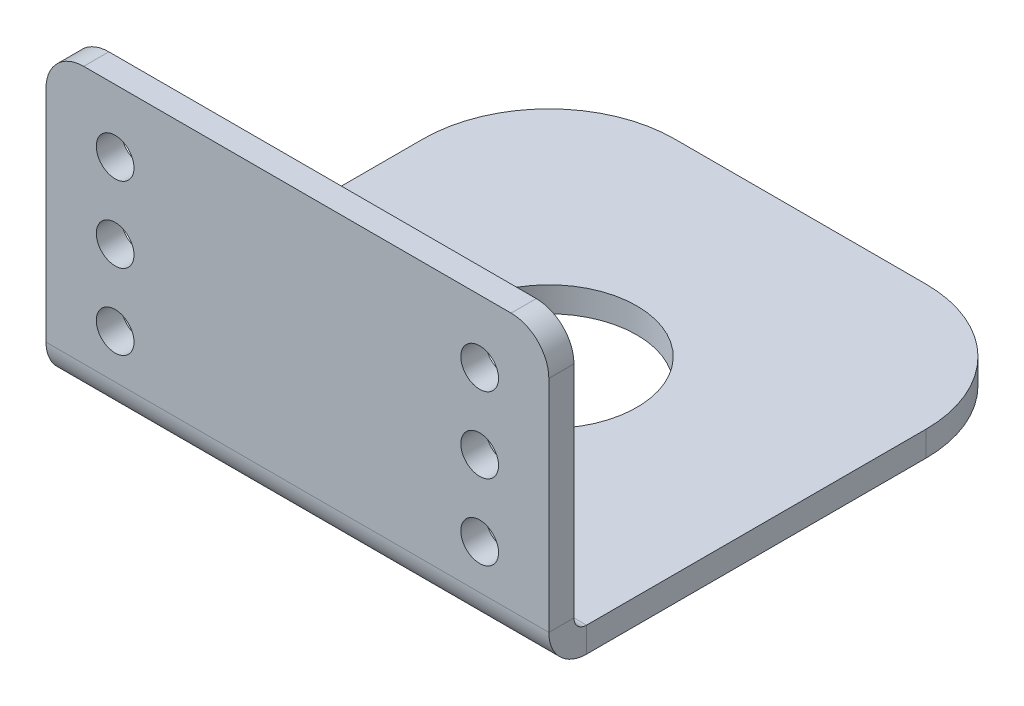
from build123d import *

# Parameters (mm, degrees)
SKETCH1_W                    = 40
SKETCH1_H                    = 38
SKETCH1_R                    = 7
SKETCH1_R_2                  = 1.5
BASE_FLANGE1_DEPTH           = 2
EDGE_FLANGE1_STRIP_W         = 10
EDGE_FLANGE1_STRIP_H         = 2
EDGE_FLANGE1_STRIP_CUT_DEPTH = 40
EDGE_FLANGE1_DEPTH           = 40
FILLET1_R                    = 10
FILLET2_R                    = 3
SKETCH10_R                   = 1.5
CUT_EXTRUDE1_DEPTH           = 49.023431781


# Sheet-metal steps are written as plain solids
with BuildPart() as part:
    # Sketch1 → Base-Flange1 (new body)
    with BuildSketch(Plane(origin=(0, 0, 0), x_dir=(1, 0, 0), z_dir=(0, 1, 0))):
        Rectangle(SKETCH1_W, SKETCH1_H)
        with Locations(Location((0, -1, 0), (0, 0, 270))):
            Circle(SKETCH1_R, mode=Mode.SUBTRACT)
        with Locations(Location((0, -10.5, 0), (0, 0, 270))):
            Circle(SKETCH1_R_2, mode=Mode.SUBTRACT)
    extrude(amount=-BASE_FLANGE1_DEPTH)

    # Edge-Flange1 strip (across the edge) → Edge-Flange1 strip cut (cut)
    with BuildSketch(Plane(origin=(-20, 0, 19), x_dir=(0, 0, -1), z_dir=(1, 0, 0))):
        with Locations((-4, -1)):
            Rectangle(EDGE_FLANGE1_STRIP_W, EDGE_FLANGE1_STRIP_H)
    extrude(amount=EDGE_FLANGE1_STRIP_CUT_DEPTH, mode=Mode.SUBTRACT)

    # Edge-Flange1 section (across the edge) → Edge-Flange1 (add)
    with BuildSketch(Plane(origin=(-20, 0, 19), x_dir=(0, 0, -1), z_dir=(1, 0, 0))):
        with BuildLine():
            Line((-2, 1), (-2, 21.5))
            Line((-2, 21.5), (0, 21.5))
            Line((0, 21.5), (0, 1))
            ThreePointArc((0, 1), (0.292893219, 0.292893219), (1, 0))
            Line((1, 0), (1, -2))
            ThreePointArc((1, -2), (-1.121320344, -1.121320344), (-2, 1))
        make_face()
    extrude(amount=EDGE_FLANGE1_DEPTH)

    # Fillet1
    fillet1_edges = [part.edges().sort_by_distance(p)[0] for p in [
        (-20, -1, -19),
        (20, -1, -19),
    ]]
    fillet(fillet1_edges, radius=FILLET1_R)

    # Fillet2
    fillet2_edges = [part.edges().sort_by_distance(p)[0] for p in [
        (-20, 21.5, 20),
        (20, 21.5, 20),
    ]]
    fillet(fillet2_edges, radius=FILLET2_R)

    # Sketch10 → Cut-Extrude1 (cut, through all)
    with BuildSketch(Plane(origin=(0, 0, 19), x_dir=(-1, 0, 0), z_dir=(0, 0, -1))):
        with Locations((-14.5, 16.5)):
            Circle(SKETCH10_R)
        with Locations((-14.5, 10.5)):
            Circle(SKETCH10_R)
        with Locations((-14.5, 4.5)):
            Circle(SKETCH10_R)
        with Locations(Location((14.5, 4.5, 0), (0, 0, 180))):
            Circle(SKETCH10_R)
        with Locations(Location((14.5, 10.5, 0), (0, 0, 180))):
            Circle(SKETCH10_R)
        with Locations(Location((14.5, 16.5, 0), (0, 0, 180))):
            Circle(SKETCH10_R)
    extrude(amount=-CUT_EXTRUDE1_DEPTH, mode=Mode.SUBTRACT)


solid = part.part
